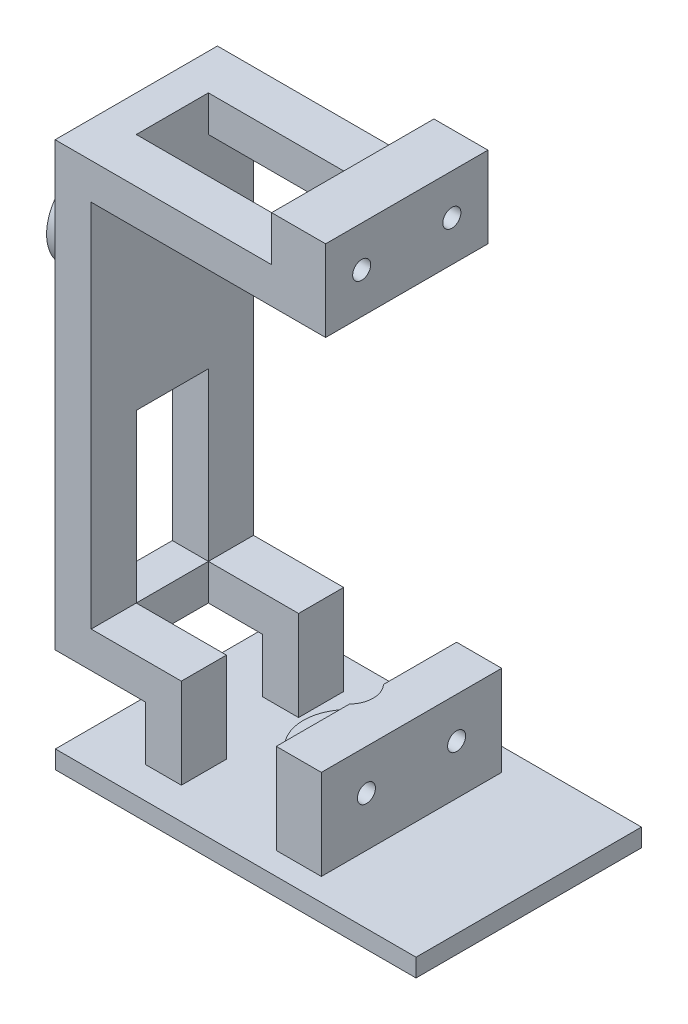
from build123d import *

# Parameters (mm, degrees)
SKETCH1_W                  = 40
SKETCH1_H                  = 25
BOSS_EXTRUDE1_DEPTH        = 2
SKETCH2_W                  = 5
SKETCH2_H                  = 20
BOSS_EXTRUDE2_DEPTH        = 10
SKETCH4_W                  = 19.965035534
SKETCH4_H                  = 6
BOSS_EXTRUDE3_DEPTH        = 5
SKETCH5_R                  = 1
CUT_EXTRUDE2_DEPTH         = 5
SKETCH6_W                  = 4
SKETCH6_H                  = 5
BOSS_EXTRUDE4_DEPTH        = 10
SKETCH8_W                  = 5
SKETCH8_H                  = 4
BOSS_EXTRUDE5_DEPTH        = 10
SKETCH9_W                  = 4
SKETCH9_H                  = 5
BOSS_EXTRUDE6_DEPTH        = 45
SKETCH12_W                 = 18
SKETCH12_H                 = 4
BOSS_EXTRUDE8_DEPTH        = 4
SKETCH13_W                 = 5
SKETCH13_H                 = 4
BOSS_EXTRUDE9_DEPTH        = 26
SKETCH14_W                 = 18
SKETCH14_H                 = 4
BOSS_EXTRUDE10_DEPTH       = 6
SKETCH16_W                 = 5.988277512
SKETCH16_H                 = 18
BOSS_EXTRUDE11_DEPTH       = 5
SKETCH15_R                 = 1
CUT_EXTRUDE3_DEPTH         = 6
SKETCH17_R                 = 3
CUT_EXTRUDE5_DEPTH         = 6
SKETCH24_W                 = 8
SKETCH24_H                 = 18.5
BOSS_EXTRUDE18_DEPTH       = 4
BOSS_EXTRUDE20_START       = -1
SKETCH20_R                 = 5
SKETCH20_R_2               = 3
BOSS_EXTRUDE20_DEPTH       = 1
BOSS_EXTRUDE21_OUTLINE_R   = 2.998308623
BOSS_EXTRUDE21_OUTLINE_R_2 = 1.5
BOSS_EXTRUDE21_DEPTH       = 1
SKETCH27_R                 = 5
SKETCH27_R_2               = 2.75
BOSS_EXTRUDE22_DEPTH       = 2
SKETCH28_R                 = 2.75
CUT_EXTRUDE10_DEPTH        = 10
SKETCH29_R                 = 5
BOSS_EXTRUDE23_DEPTH       = 5


# Read off the part's stored shape, not the designer's step: Boss-Extrude21
with BuildPart() as part:
    # Sketch1 → Boss-Extrude1 (new body)
    with BuildSketch(Plane(origin=(0, 0, 0), x_dir=(1, 0, 0), z_dir=(0, 1, 0))):
        Rectangle(SKETCH1_W, SKETCH1_H)
    extrude(amount=BOSS_EXTRUDE1_DEPTH)

    # Sketch2 → Boss-Extrude2 (add)
    with BuildSketch(Plane(origin=(0, 2, 0), x_dir=(1, 0, 0), z_dir=(0, 1, 0))):
        with Locations((4.5, 0)):
            Rectangle(SKETCH2_W, SKETCH2_H)
    extrude(amount=BOSS_EXTRUDE2_DEPTH)

    # Sketch4 → Boss-Extrude3 (add)
    with BuildSketch(Plane(origin=(7, 0, 0), x_dir=(0, 0, -1), z_dir=(1, 0, 0))):
        with Locations((-0.017482233, 9)):
            Rectangle(SKETCH4_W, SKETCH4_H)
    extrude(amount=-BOSS_EXTRUDE3_DEPTH)

    # Sketch5 → Cut-Extrude2 (cut)
    with BuildSketch(Plane(origin=(7, 0, 0), x_dir=(0, 0, -1), z_dir=(1, 0, 0))):
        with Locations((5, 7.5)):
            Circle(SKETCH5_R)
        with Locations((-5, 7.5)):
            Circle(SKETCH5_R)
    extrude(amount=-CUT_EXTRUDE2_DEPTH, mode=Mode.SUBTRACT)

    # Sketch6 → Boss-Extrude4 (add)
    with BuildSketch(Plane(origin=(0, 2, 0), x_dir=(1, 0, 0), z_dir=(0, 1, 0))):
        with Locations((-11.527661753, -6.5)):
            Rectangle(SKETCH6_W, SKETCH6_H)
        with Locations((-11.527661753, 6.5)):
            Rectangle(SKETCH6_W, SKETCH6_H)
    extrude(amount=BOSS_EXTRUDE4_DEPTH)

    # Sketch8 → Boss-Extrude5 (add)
    with BuildSketch(Plane.ZY.offset(13.527661753)):
        with Locations((-6.5, 10)):
            Rectangle(SKETCH8_W, SKETCH8_H)
    boss_extrude5 = extrude(amount=BOSS_EXTRUDE5_DEPTH)

    # Mirror1: Boss-Extrude5 across plane
    add(boss_extrude5.mirror(Plane(origin=(0, 0, 0), x_dir=(1, 0, 0), z_dir=(0, 0, -1))))

    # Sketch9 → Boss-Extrude6 (add)
    with BuildSketch(Plane(origin=(0, 12, 0), x_dir=(1, 0, 0), z_dir=(0, 1, 0))):
        with Locations((-21.527661753, 6.5)):
            Rectangle(SKETCH9_W, SKETCH9_H)
    boss_extrude6 = extrude(amount=BOSS_EXTRUDE6_DEPTH)

    # Mirror2: Boss-Extrude5 across plane
    add(boss_extrude5.mirror(Plane(origin=(0, 0, 0), x_dir=(1, 0, 0), z_dir=(0, 0, -1))))

    # Mirror3: Boss-Extrude6 across plane
    add(boss_extrude6.mirror(Plane(origin=(0, 0, 0), x_dir=(1, 0, 0), z_dir=(0, 0, -1))))

    # Sketch12 → Boss-Extrude8 (add)
    with BuildSketch(Plane.ZY.offset(23.527661753)):
        with Locations((0, 55)):
            Rectangle(SKETCH12_W, SKETCH12_H)
        with Locations((0, 10)):
            Rectangle(SKETCH12_W, SKETCH12_H)
        with Locations((0, 32.5)):
            Rectangle(SKETCH12_W, SKETCH12_H)
    extrude(amount=-BOSS_EXTRUDE8_DEPTH)

    # Sketch13 → Boss-Extrude9 (add)
    with BuildSketch(Plane(origin=(-19.527661753, 0, 0), x_dir=(0, 0, -1), z_dir=(1, 0, 0))):
        with Locations((-6.5, 55)):
            Rectangle(SKETCH13_W, SKETCH13_H)
        with Locations((6.5, 55)):
            Rectangle(SKETCH13_W, SKETCH13_H)
    extrude(amount=BOSS_EXTRUDE9_DEPTH)

    # Sketch14 → Boss-Extrude10 (add)
    with BuildSketch(Plane(origin=(6.472338247, 0, 0), x_dir=(0, 0, -1), z_dir=(1, 0, 0))):
        with Locations((0, 55)):
            Rectangle(SKETCH14_W, SKETCH14_H)
    extrude(amount=-BOSS_EXTRUDE10_DEPTH)

    # Sketch16 → Boss-Extrude11 (add)
    with BuildSketch(Plane(origin=(0, 57, 0), x_dir=(1, 0, 0), z_dir=(0, 1, 0))):
        with Locations((3.478199491, 0)):
            Rectangle(SKETCH16_W, SKETCH16_H)
    extrude(amount=BOSS_EXTRUDE11_DEPTH)

    # Sketch15 → Cut-Extrude3 (cut)
    with BuildSketch(Plane(origin=(6.472338247, 0, 0), x_dir=(0, 0, -1), z_dir=(1, 0, 0))):
        with Locations((-5, 57.5)):
            Circle(SKETCH15_R)
        with Locations((5, 57.5)):
            Circle(SKETCH15_R)
    extrude(amount=-CUT_EXTRUDE3_DEPTH, mode=Mode.SUBTRACT)

    # Sketch17 → Cut-Extrude5 (cut)
    with BuildSketch(Plane.XZ):
        with Locations(Location((0, 0, 0), (0, 0, 270))):
            Circle(SKETCH17_R)
    extrude(amount=-CUT_EXTRUDE5_DEPTH, mode=Mode.SUBTRACT)

    # Sketch24 → Boss-Extrude18 (add)
    with BuildSketch(Plane.ZY.offset(23.527661753)):
        with Locations((0, 43.75)):
            Rectangle(SKETCH24_W, SKETCH24_H)
    extrude(amount=-BOSS_EXTRUDE18_DEPTH)

    # Sketch20 → Boss-Extrude20 (add)
    with BuildSketch(Plane(origin=(0, 3, 0), x_dir=(1, 0, 0), z_dir=(0, 1, 0)).offset(BOSS_EXTRUDE20_START)):
        Circle(SKETCH20_R)
        with Locations(Location((0, 0, 0), (0, 0, 90))):
            Circle(SKETCH20_R_2, mode=Mode.SUBTRACT)
    extrude(amount=BOSS_EXTRUDE20_DEPTH)

    # Boss-Extrude21 outline → Boss-Extrude21 (add)
    # profile 1 of 2: a face of its own
    with BuildSketch(Plane(origin=(0, 3, 0), x_dir=(1, 0, 0), z_dir=(0, 1, 0))):
        with BuildLine():
            ThreePointArc((2, -2.236067977), (-3, 0), (2, 2.236067977))
            Line((2, 2.236067977), (2, 4.582575695))
            ThreePointArc((2, 4.582575695), (-5, 0), (2, -4.582575695))
            Line((2, -4.582575695), (2, -2.236067977))
        make_face()
    # profile 2 of 2: a face of its own
    with BuildSketch(Plane(origin=(0, 3, 0), x_dir=(1, 0, 0), z_dir=(0, 1, 0))):
        Circle(BOSS_EXTRUDE21_OUTLINE_R)
        Circle(BOSS_EXTRUDE21_OUTLINE_R_2, mode=Mode.SUBTRACT)
    extrude(amount=BOSS_EXTRUDE21_DEPTH)

    # Sketch27 → Boss-Extrude22 (add)
    with BuildSketch(Plane(origin=(0, 4, 0), x_dir=(1, 0, 0), z_dir=(0, 1, 0))):
        Circle(SKETCH27_R)
        with Locations(Location((0, 0, 0), (0, 0, 43.341758227))):
            Circle(SKETCH27_R_2, mode=Mode.SUBTRACT)
    extrude(amount=BOSS_EXTRUDE22_DEPTH)

    # Sketch28 → Cut-Extrude10 (cut)
    with BuildSketch(Plane(origin=(0, 6, 0), x_dir=(1, 0, 0), z_dir=(0, 1, 0))):
        with Locations(Location((0, 0, 0), (0, 0, 43.341758227))):
            Circle(SKETCH28_R)
    extrude(amount=CUT_EXTRUDE10_DEPTH, mode=Mode.SUBTRACT)

    # Sketch29 → Boss-Extrude23 (add)
    with BuildSketch(Plane.ZY.offset(23.527661753)):
        with Locations((-0.05, 43.4)):
            Circle(SKETCH29_R)
    extrude(amount=BOSS_EXTRUDE23_DEPTH)


solid = part.part
